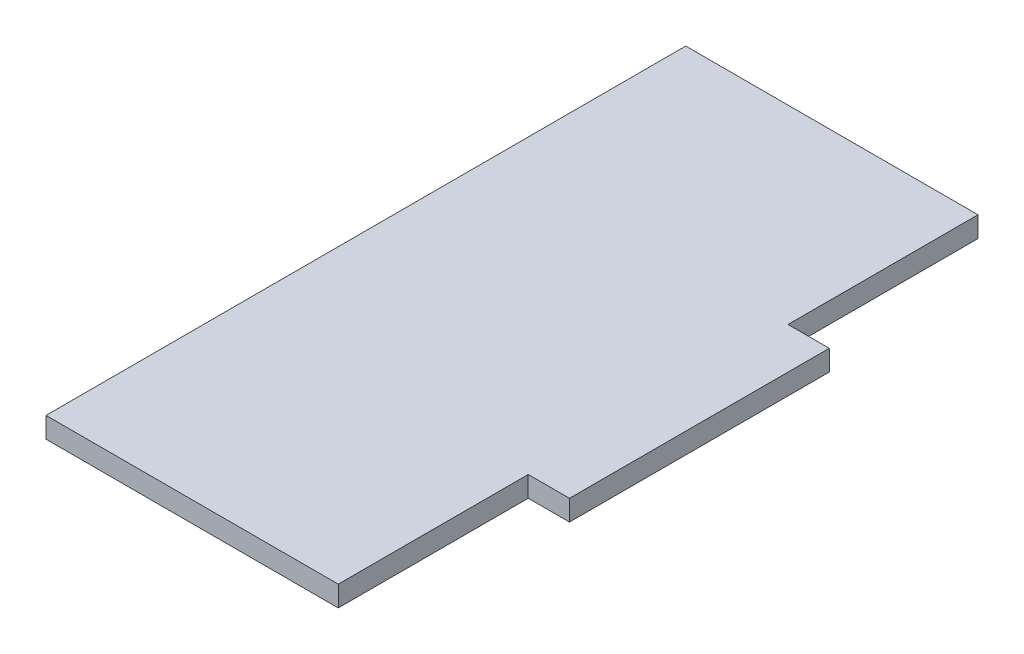
from build123d import *

# Parameters (mm, degrees)
BOSS_EXTRUDE1_DEPTH = 3.175


with BuildPart() as part:
    # Sketch1 → Boss-Extrude1 (new body)
    with BuildSketch(Plane(origin=(0, 0, 0), x_dir=(1, 0, 0), z_dir=(0, 1, 0))):
        Polygon((22.5, 29.25), (-22.5, 29.25), (-22.5, 0), (-22.5, -40), (-22.5, -69.25), (22.5, -69.25), (22.5, -40), (28.85, -40), (28.85, 0), (22.5, 0), align=None)
    extrude(amount=BOSS_EXTRUDE1_DEPTH)


solid = part.part
